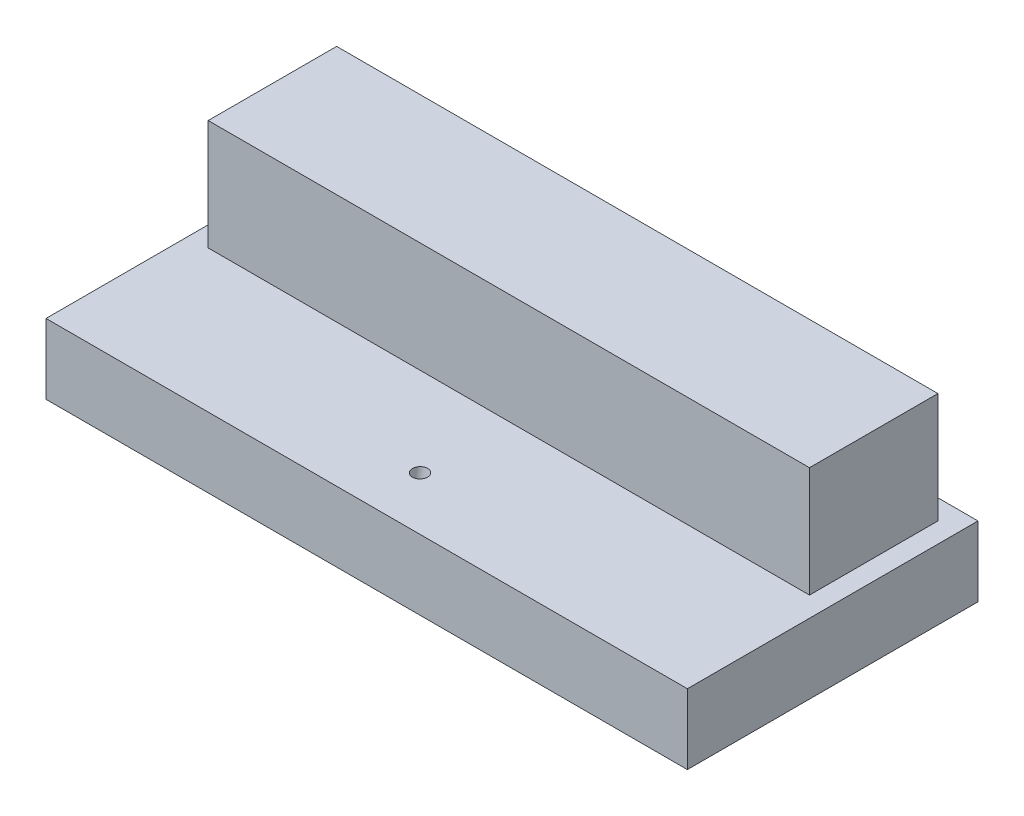
from build123d import *

# Parameters (mm, degrees)
SKETCH1_W           = 120
SKETCH1_H           = 25.630963903
BOSS_EXTRUDE1_DEPTH = 22.019128
SKETCH2_W           = 128
SKETCH2_H           = 58
BOSS_EXTRUDE2_DEPTH = 13.980872
CAVITY1_START       = -22.548845462
CAVITY1_OUTLINE_R   = 3.5
CAVITY1_DEPTH       = 8.988590673
CAVITY1_START_2     = -13.560254789
CAVITY1_2_OUTLINE_R = 1.5
CAVITY1_2_DEPTH     = 6.049448343


# Read off the part's stored shape, not the designer's step: Cavity1
with BuildPart() as part:
    # Sketch1 → Boss-Extrude1 (new body)
    with BuildSketch(Plane.XZ.offset(-14.278818257)):
        with Locations((-20.964398438, -29.724047508)):
            Rectangle(SKETCH1_W, SKETCH1_H)
    extrude(amount=BOSS_EXTRUDE1_DEPTH)


with BuildPart() as boss_extrude2_tool:
    # Sketch2 → Boss-Extrude2 (new body)
    with BuildSketch(Plane.XZ.offset(7.740310225)):
        with Locations((-20.964398438, -17.53952946)):
            Rectangle(SKETCH2_W, SKETCH2_H)
    extrude(amount=BOSS_EXTRUDE2_DEPTH)


with BuildPart() as part_1:
    add(part.part)


with BuildPart() as part_2:
    # Boss-Extrude2: joined with boss_extrude2_tool
    add(part_1.part.fuse(boss_extrude2_tool.part, tol=0.00001))

    # Cavity1 outline → Cavity1 (cut)
    with BuildSketch(Plane(origin=(0, 0, 0), x_dir=(1, 0, 0), z_dir=(0, 0.9857095962326692, -0.16845353037211303)).offset(CAVITY1_START)):
        with Locations((-20.964398438, 0.499578973)):
            Circle(CAVITY1_OUTLINE_R)
    extrude(amount=CAVITY1_DEPTH, mode=Mode.SUBTRACT)

    # Cavity1 2 outline → Cavity1 2 (cut)
    with BuildSketch(Plane(origin=(0, 0, 0), x_dir=(1, 0, 0), z_dir=(0, 0.9857095962326692, -0.16845353037211303)).offset(CAVITY1_START_2)):
        with Locations((-20.964398438, 0.499578973)):
            Circle(CAVITY1_2_OUTLINE_R)
    extrude(amount=CAVITY1_2_DEPTH, mode=Mode.SUBTRACT)


solid = part_2.part
